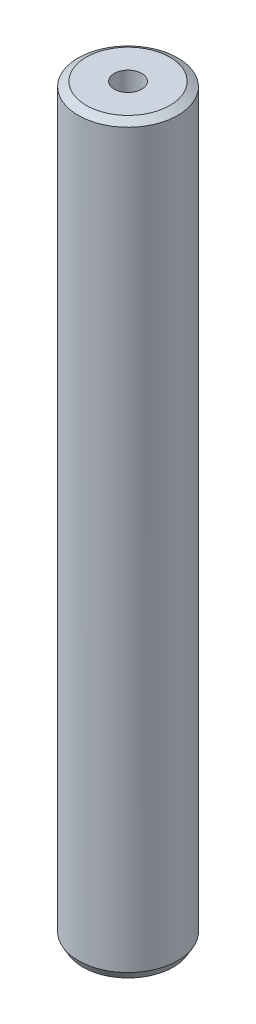
from build123d import *
from OCP.BRepFilletAPI import BRepFilletAPI_MakeChamfer

# Parameters (mm, degrees)
SKETCH1_R           = 17.5
BOSS_EXTRUDE1_DEPTH = 261.607179482
SKETCH2_R           = 4.820861696
CUT_EXTRUDE1_DEPTH  = 263.77522021
CHAMFER1_SIZE       = 1.621512533
CHAMFER1_SIZE2      = 2.808542092


with BuildPart() as part:
    # Sketch1 → Boss-Extrude1 (new body)
    with BuildSketch(Plane(origin=(0, 0, 0), x_dir=(1, 0, 0), z_dir=(0, 1, 0))):
        Circle(SKETCH1_R)
    extrude(amount=BOSS_EXTRUDE1_DEPTH)

    # Sketch2 → Cut-Extrude1 (cut, through all)
    with BuildSketch(Plane(origin=(0, 0, 0), x_dir=(1, 0, 0), z_dir=(0, 1, 0))):
        Circle(SKETCH2_R)
    extrude(amount=CUT_EXTRUDE1_DEPTH, mode=Mode.SUBTRACT)

    # Chamfer1: one chamfer whose edges measure the first distance from different faces: ONE call of the kernel's chamfer builder (chamfer() names one face for all edges)
    chamfer1_edges_1 = [part.edges().sort_by_distance(p)[0] for p in [
        (-17.5, 261.607179482, 0),
    ]]
    chamfer1_side_1 = [part.faces().sort_by_distance(p)[0] for p in [
        (-17.5, 130.803589741, 0),
    ]]
    chamfer1_edges_2 = [part.edges().sort_by_distance(p)[0] for p in [
        (-17.5, 0, 0),
    ]]
    chamfer1_side_2 = [part.faces().sort_by_distance(p)[0] for p in [
        (-17.005025253, 0, 0),
    ]]
    chamfer1 = BRepFilletAPI_MakeChamfer(part.part.solid().wrapped)
    for e in chamfer1_edges_1:
        chamfer1.Add(CHAMFER1_SIZE, CHAMFER1_SIZE2, e.wrapped, chamfer1_side_1[0].wrapped)  # the first distance lies on this face
    for e in chamfer1_edges_2:
        chamfer1.Add(CHAMFER1_SIZE, CHAMFER1_SIZE2, e.wrapped, chamfer1_side_2[0].wrapped)  # the first distance lies on this face
    add(Compound.cast(chamfer1.Shape()), mode=Mode.REPLACE)


solid = part.part
